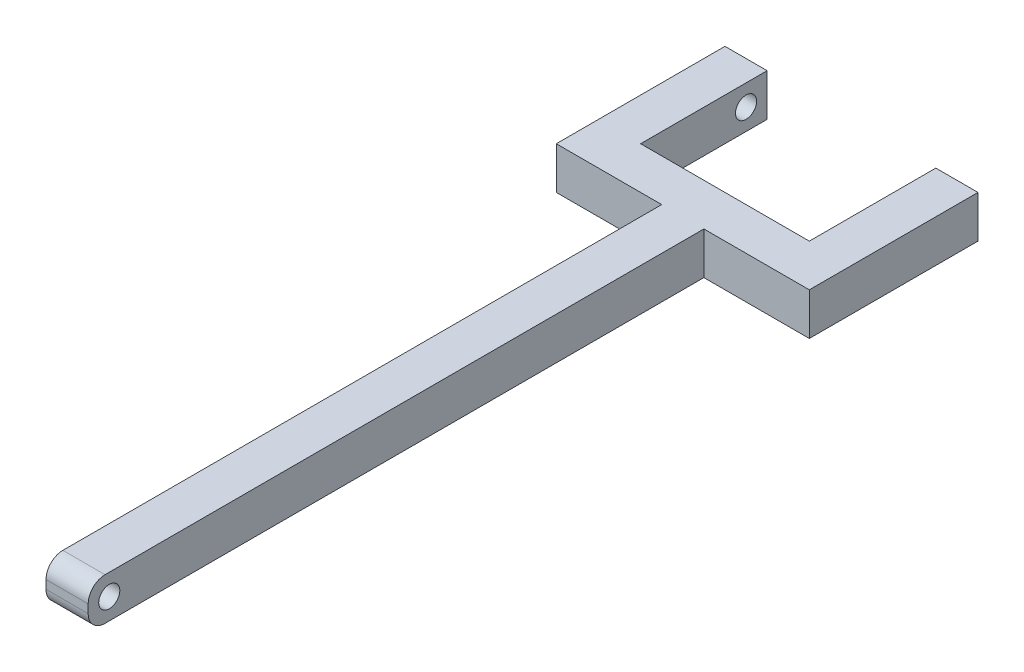
from build123d import *

# Parameters (mm, degrees)
SKETCH1_W           = 12.7
SKETCH1_H           = 12.7
BOSS_EXTRUDE1_DEPTH = 92.71
SKETCH4_W           = 12.7
SKETCH4_H           = 12.7
BOSS_EXTRUDE2_DEPTH = 38.1
SKETCH5_W           = 12.7
SKETCH5_H           = 12.7
BOSS_EXTRUDE3_DEPTH = 38.1
SKETCH6_R           = 3.175
CUT_EXTRUDE1_DEPTH  = 6.35
SKETCH7_R           = 3.175
CUT_EXTRUDE2_DEPTH  = 151.370359779
FILLET1_R           = 5.08


with BuildPart() as part:
    # Sketch1 → Boss-Extrude1 (new, symmetric)
    with BuildSketch(Plane.XY):
        Rectangle(SKETCH1_W, SKETCH1_H)
    extrude(amount=BOSS_EXTRUDE1_DEPTH, both=True)

    # Sketch4 → Boss-Extrude2 (add, symmetric)
    with BuildSketch(Plane(origin=(0, 0, 0), x_dir=(0, 0, -1), z_dir=(1, 0, 0))):
        with Locations((99.06, 0)):
            Rectangle(SKETCH4_W, SKETCH4_H)
    extrude(amount=BOSS_EXTRUDE2_DEPTH, both=True)

    # Sketch5 → Boss-Extrude3 (add)
    with BuildSketch(Plane(origin=(0, 0, -105.41), x_dir=(-1, 0, 0), z_dir=(0, 0, -1))):
        with Locations((-31.75, 0)):
            Rectangle(SKETCH5_W, SKETCH5_H)
    boss_extrude3 = extrude(amount=BOSS_EXTRUDE3_DEPTH)

    # Sketch6 → Cut-Extrude1 (cut)
    with BuildSketch(Plane.ZY.offset(-25.4)):
        with Locations((-137.16, 0)):
            Circle(SKETCH6_R)
    cut_extrude1 = extrude(amount=-CUT_EXTRUDE1_DEPTH, mode=Mode.SUBTRACT)

    # Mirror1: Boss-Extrude3, Cut-Extrude1 across plane
    add(boss_extrude3.mirror(Plane(origin=(0, 0, 0), x_dir=(0, 0, 1), z_dir=(1, 0, 0))))
    add(cut_extrude1.mirror(Plane(origin=(0, 0, 0), x_dir=(0, 0, 1), z_dir=(1, 0, 0))), mode=Mode.SUBTRACT)

    # Sketch7 → Cut-Extrude2 (cut, through all)
    with BuildSketch(Plane.ZY.offset(6.35)):
        with Locations((86.36, 0)):
            Circle(SKETCH7_R)
    extrude(amount=-CUT_EXTRUDE2_DEPTH, mode=Mode.SUBTRACT)

    # Fillet1
    fillet1_edges = [part.edges().sort_by_distance(p)[0] for p in [
        (0, -6.35, 92.71),
        (0, 6.35, 92.71),
    ]]
    fillet(fillet1_edges, radius=FILLET1_R)


solid = part.part
